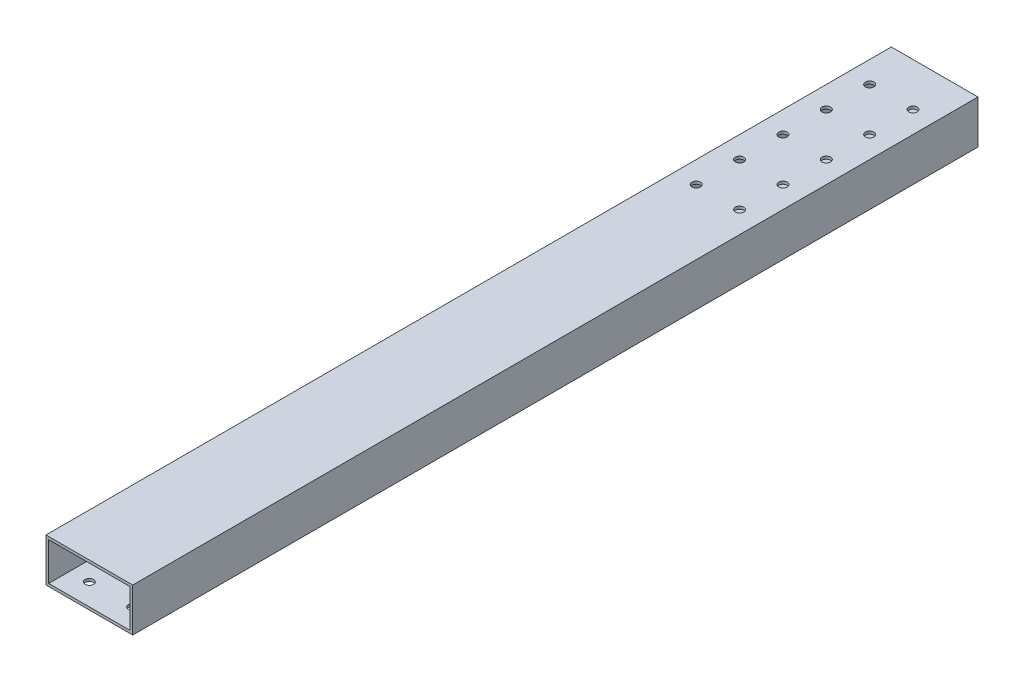
from build123d import *

# Parameters (mm, degrees)
SKETCH1_W           = 50.8
SKETCH1_H           = 25.4
BOSS_EXTRUDE1_DEPTH = 495.3
SHELL1_T            = -1.5875
CUT_EXTRUDE1_REACH  = 498.601
SKETCH2_R           = 2.4892
CUT_EXTRUDE2_REACH  = 498.601
SKETCH3_R           = 2.4892


with BuildPart() as part:
    # Sketch1 → Boss-Extrude1 (new body)
    with BuildSketch(Plane.XY):
        Rectangle(SKETCH1_W, SKETCH1_H)
    extrude(amount=BOSS_EXTRUDE1_DEPTH)

    # Shell1
    shell1_openings = [part.faces().sort_by_distance(p)[0] for p in [
        (0, 0, 0),
        (0, 0, 495.3),
    ]]
    offset(amount=SHELL1_T, openings=shell1_openings, kind=Kind.INTERSECTION)

    # Sketch2 → Cut-Extrude1 (cut, up to next)
    with BuildSketch(Plane(origin=(0, 12.7, 0), x_dir=(1, 0, 0), z_dir=(0, 1, 0)), mode=Mode.PRIVATE) as cut_extrude1_sk1:
        with Locations((-12.7, -25.4)):
            Circle(SKETCH2_R)
    cut_extrude1_tool1 = extrude(cut_extrude1_sk1.sketch, amount=-CUT_EXTRUDE1_REACH, mode=Mode.PRIVATE) & part.part
    # Sketch2 → Cut-Extrude1 (cut, up to next)
    with BuildSketch(Plane(origin=(0, 12.7, 0), x_dir=(1, 0, 0), z_dir=(0, 1, 0)), mode=Mode.PRIVATE) as cut_extrude1_sk2:
        with Locations((12.7, -25.4)):
            Circle(SKETCH2_R)
    cut_extrude1_tool2 = extrude(cut_extrude1_sk2.sketch, amount=-CUT_EXTRUDE1_REACH, mode=Mode.PRIVATE) & part.part
    # Sketch2 → Cut-Extrude1 (cut, up to next)
    with BuildSketch(Plane(origin=(0, 12.7, 0), x_dir=(1, 0, 0), z_dir=(0, 1, 0)), mode=Mode.PRIVATE) as cut_extrude1_sk3:
        with Locations((12.7, -50.8)):
            Circle(SKETCH2_R)
    cut_extrude1_tool3 = extrude(cut_extrude1_sk3.sketch, amount=-CUT_EXTRUDE1_REACH, mode=Mode.PRIVATE) & part.part
    # Sketch2 → Cut-Extrude1 (cut, up to next)
    with BuildSketch(Plane(origin=(0, 12.7, 0), x_dir=(1, 0, 0), z_dir=(0, 1, 0)), mode=Mode.PRIVATE) as cut_extrude1_sk4:
        with Locations((12.7, -76.2)):
            Circle(SKETCH2_R)
    cut_extrude1_tool4 = extrude(cut_extrude1_sk4.sketch, amount=-CUT_EXTRUDE1_REACH, mode=Mode.PRIVATE) & part.part
    # Sketch2 → Cut-Extrude1 (cut, up to next)
    with BuildSketch(Plane(origin=(0, 12.7, 0), x_dir=(1, 0, 0), z_dir=(0, 1, 0)), mode=Mode.PRIVATE) as cut_extrude1_sk5:
        with Locations((12.7, -101.6)):
            Circle(SKETCH2_R)
    cut_extrude1_tool5 = extrude(cut_extrude1_sk5.sketch, amount=-CUT_EXTRUDE1_REACH, mode=Mode.PRIVATE) & part.part
    # Sketch2 → Cut-Extrude1 (cut, up to next)
    with BuildSketch(Plane(origin=(0, 12.7, 0), x_dir=(1, 0, 0), z_dir=(0, 1, 0)), mode=Mode.PRIVATE) as cut_extrude1_sk6:
        with Locations((12.7, -127)):
            Circle(SKETCH2_R)
    cut_extrude1_tool6 = extrude(cut_extrude1_sk6.sketch, amount=-CUT_EXTRUDE1_REACH, mode=Mode.PRIVATE) & part.part
    # Sketch2 → Cut-Extrude1 (cut, up to next)
    with BuildSketch(Plane(origin=(0, 12.7, 0), x_dir=(1, 0, 0), z_dir=(0, 1, 0)), mode=Mode.PRIVATE) as cut_extrude1_sk7:
        with Locations((-12.7, -50.8)):
            Circle(SKETCH2_R)
    cut_extrude1_tool7 = extrude(cut_extrude1_sk7.sketch, amount=-CUT_EXTRUDE1_REACH, mode=Mode.PRIVATE) & part.part
    # Sketch2 → Cut-Extrude1 (cut, up to next)
    with BuildSketch(Plane(origin=(0, 12.7, 0), x_dir=(1, 0, 0), z_dir=(0, 1, 0)), mode=Mode.PRIVATE) as cut_extrude1_sk8:
        with Locations((-12.7, -76.2)):
            Circle(SKETCH2_R)
    cut_extrude1_tool8 = extrude(cut_extrude1_sk8.sketch, amount=-CUT_EXTRUDE1_REACH, mode=Mode.PRIVATE) & part.part
    # Sketch2 → Cut-Extrude1 (cut, up to next)
    with BuildSketch(Plane(origin=(0, 12.7, 0), x_dir=(1, 0, 0), z_dir=(0, 1, 0)), mode=Mode.PRIVATE) as cut_extrude1_sk9:
        with Locations((-12.7, -101.6)):
            Circle(SKETCH2_R)
    cut_extrude1_tool9 = extrude(cut_extrude1_sk9.sketch, amount=-CUT_EXTRUDE1_REACH, mode=Mode.PRIVATE) & part.part
    # Sketch2 → Cut-Extrude1 (cut, up to next)
    with BuildSketch(Plane(origin=(0, 12.7, 0), x_dir=(1, 0, 0), z_dir=(0, 1, 0)), mode=Mode.PRIVATE) as cut_extrude1_sk10:
        with Locations((-12.7, -127)):
            Circle(SKETCH2_R)
    cut_extrude1_tool10 = extrude(cut_extrude1_sk10.sketch, amount=-CUT_EXTRUDE1_REACH, mode=Mode.PRIVATE) & part.part
    add(cut_extrude1_tool1.solids().sort_by_distance((-12.7, 12.7, 25.4))[0], mode=Mode.SUBTRACT)
    add(cut_extrude1_tool2.solids().sort_by_distance((12.7, 12.7, 25.4))[0], mode=Mode.SUBTRACT)
    add(cut_extrude1_tool3.solids().sort_by_distance((12.7, 12.7, 50.8))[0], mode=Mode.SUBTRACT)
    add(cut_extrude1_tool4.solids().sort_by_distance((12.7, 12.7, 76.2))[0], mode=Mode.SUBTRACT)
    add(cut_extrude1_tool5.solids().sort_by_distance((12.7, 12.7, 101.6))[0], mode=Mode.SUBTRACT)
    add(cut_extrude1_tool6.solids().sort_by_distance((12.7, 12.7, 127))[0], mode=Mode.SUBTRACT)
    add(cut_extrude1_tool7.solids().sort_by_distance((-12.7, 12.7, 50.8))[0], mode=Mode.SUBTRACT)
    add(cut_extrude1_tool8.solids().sort_by_distance((-12.7, 12.7, 76.2))[0], mode=Mode.SUBTRACT)
    add(cut_extrude1_tool9.solids().sort_by_distance((-12.7, 12.7, 101.6))[0], mode=Mode.SUBTRACT)
    add(cut_extrude1_tool10.solids().sort_by_distance((-12.7, 12.7, 127))[0], mode=Mode.SUBTRACT)

    # Sketch3 → Cut-Extrude2 (cut, up to next)
    with BuildSketch(Plane.XZ.offset(12.7), mode=Mode.PRIVATE) as cut_extrude2_sk1:
        with Locations((-12.7, 457.2)):
            Circle(SKETCH3_R)
    cut_extrude2_tool1 = extrude(cut_extrude2_sk1.sketch, amount=-CUT_EXTRUDE2_REACH, mode=Mode.PRIVATE) & part.part
    # Sketch3 → Cut-Extrude2 (cut, up to next)
    with BuildSketch(Plane.XZ.offset(12.7), mode=Mode.PRIVATE) as cut_extrude2_sk2:
        with Locations((12.7, 457.2)):
            Circle(SKETCH3_R)
    cut_extrude2_tool2 = extrude(cut_extrude2_sk2.sketch, amount=-CUT_EXTRUDE2_REACH, mode=Mode.PRIVATE) & part.part
    # Sketch3 → Cut-Extrude2 (cut, up to next)
    with BuildSketch(Plane.XZ.offset(12.7), mode=Mode.PRIVATE) as cut_extrude2_sk3:
        with Locations((12.7, 469.9)):
            Circle(SKETCH3_R)
    cut_extrude2_tool3 = extrude(cut_extrude2_sk3.sketch, amount=-CUT_EXTRUDE2_REACH, mode=Mode.PRIVATE) & part.part
    # Sketch3 → Cut-Extrude2 (cut, up to next)
    with BuildSketch(Plane.XZ.offset(12.7), mode=Mode.PRIVATE) as cut_extrude2_sk4:
        with Locations((12.7, 482.6)):
            Circle(SKETCH3_R)
    cut_extrude2_tool4 = extrude(cut_extrude2_sk4.sketch, amount=-CUT_EXTRUDE2_REACH, mode=Mode.PRIVATE) & part.part
    # Sketch3 → Cut-Extrude2 (cut, up to next)
    with BuildSketch(Plane.XZ.offset(12.7), mode=Mode.PRIVATE) as cut_extrude2_sk5:
        with Locations((-12.7, 469.9)):
            Circle(SKETCH3_R)
    cut_extrude2_tool5 = extrude(cut_extrude2_sk5.sketch, amount=-CUT_EXTRUDE2_REACH, mode=Mode.PRIVATE) & part.part
    # Sketch3 → Cut-Extrude2 (cut, up to next)
    with BuildSketch(Plane.XZ.offset(12.7), mode=Mode.PRIVATE) as cut_extrude2_sk6:
        with Locations((-12.7, 482.6)):
            Circle(SKETCH3_R)
    cut_extrude2_tool6 = extrude(cut_extrude2_sk6.sketch, amount=-CUT_EXTRUDE2_REACH, mode=Mode.PRIVATE) & part.part
    add(cut_extrude2_tool1.solids().sort_by_distance((-12.7, -12.7, 457.2))[0], mode=Mode.SUBTRACT)
    add(cut_extrude2_tool2.solids().sort_by_distance((12.7, -12.7, 457.2))[0], mode=Mode.SUBTRACT)
    add(cut_extrude2_tool3.solids().sort_by_distance((12.7, -12.7, 469.9))[0], mode=Mode.SUBTRACT)
    add(cut_extrude2_tool4.solids().sort_by_distance((12.7, -12.7, 482.6))[0], mode=Mode.SUBTRACT)
    add(cut_extrude2_tool5.solids().sort_by_distance((-12.7, -12.7, 469.9))[0], mode=Mode.SUBTRACT)
    add(cut_extrude2_tool6.solids().sort_by_distance((-12.7, -12.7, 482.6))[0], mode=Mode.SUBTRACT)


solid = part.part
